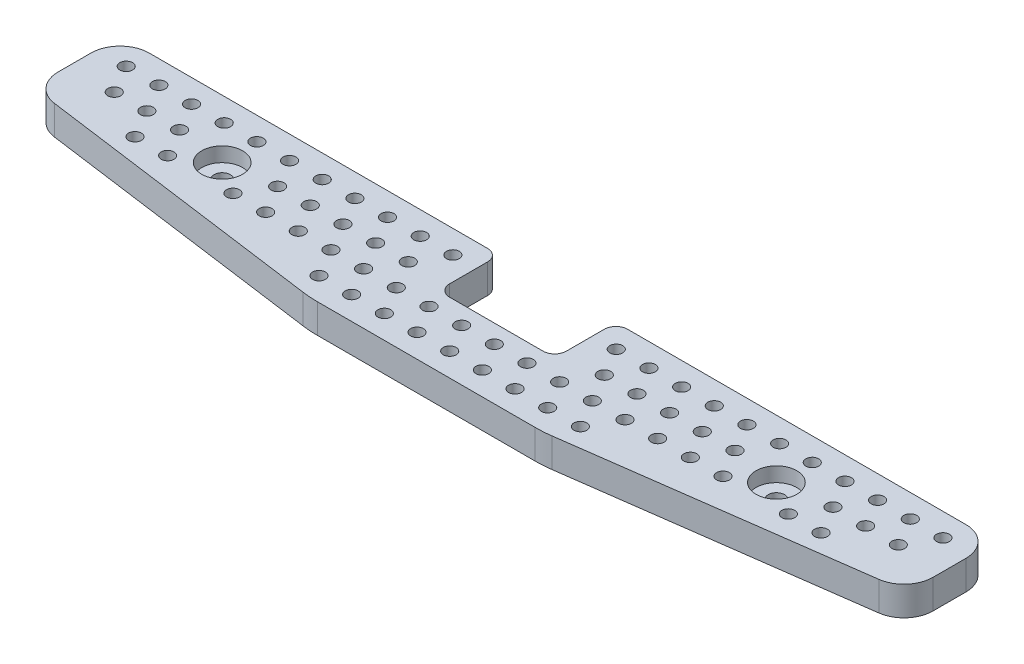
from build123d import *

# Parameters (mm, degrees)
SKETCH1_R               = 1.778
BOSS_EXTRUDE1_DEPTH     = 6.35
SKETCH2_R               = 1.397
CUT_EXTRUDE1_DEPTH      = 100.646453148
FILL_PATTERN1_OUTLINE_R = 1.397
FILL_PATTERN1_DEPTH     = 6.35
SKETCH3_R               = 4.445
CUT_EXTRUDE2_DEPTH      = 3.175


# Read off the part's stored shape, not the designer's step: Fill Pattern1
with BuildPart() as part:
    # Sketch1 → Boss-Extrude1 (new body)
    with BuildSketch(Plane(origin=(0, 0, 0), x_dir=(1, 0, 0), z_dir=(0, 1, 0))):
        with BuildLine():
            Line((23.676158632, 0), (-23.676158632, 0))
            ThreePointArc((-23.676158632, 0), (-25.396043626, 0.058295329), (-27.108034032, 0.232913732))
            Line((-27.108034032, 0.232913732), (-89.75796885, 8.776086661))
            ThreePointArc((-89.75796885, 8.776086661), (-93.68385839, 10.892071009), (-95.25, 15.067858228))
            Line((-95.25, 15.067858228), (-95.25, 22.225))
            ThreePointArc((-95.25, 22.225), (-93.390128061, 26.715128061), (-88.9, 28.575))
            Line((-88.9, 28.575), (-15.24, 28.575))
            ThreePointArc((-15.24, 28.575), (-13.443948776, 27.831051224), (-12.7, 26.035))
            Line((-12.7, 26.035), (-12.7, 17.78))
            ThreePointArc((-12.7, 17.78), (-11.956051224, 15.983948776), (-10.16, 15.24))
            Line((-10.16, 15.24), (10.16, 15.24))
            ThreePointArc((10.16, 15.24), (11.956051224, 15.983948776), (12.7, 17.78))
            Line((12.7, 17.78), (12.7, 26.035))
            ThreePointArc((12.7, 26.035), (13.443948776, 27.831051224), (15.24, 28.575))
            Line((15.24, 28.575), (88.9, 28.575))
            ThreePointArc((88.9, 28.575), (93.390128061, 26.715128061), (95.25, 22.225))
            Line((95.25, 22.225), (95.25, 15.067858228))
            ThreePointArc((95.25, 15.067858228), (93.68385839, 10.892071009), (89.75796885, 8.776086661))
            Line((89.75796885, 8.776086661), (27.108034032, 0.232913732))
            ThreePointArc((27.108034032, 0.232913732), (25.396043626, 0.058295329), (23.676158632, 0))
        make_face()
        with Locations(Location((-60.325, 15.875, 0), (0, 0, 270))):
            Circle(SKETCH1_R, mode=Mode.SUBTRACT)
        with Locations(Location((60.325, 15.875, 0), (0, 0, 90))):
            Circle(SKETCH1_R, mode=Mode.SUBTRACT)
    extrude(amount=BOSS_EXTRUDE1_DEPTH)

    # Sketch2 → Cut-Extrude1 (cut, through all)
    with BuildSketch(Plane(origin=(0, 0, 0), x_dir=(1, 0, 0), z_dir=(0, 1, 0))):
        with Locations(Location((0, 5.08, 0), (0, 0, 270))):
            Circle(SKETCH2_R)
    extrude(amount=CUT_EXTRUDE1_DEPTH, mode=Mode.SUBTRACT)

    # Fill Pattern1 outline → Fill Pattern1 (cut)
    with BuildSketch(Plane(origin=(0, 0, 0), x_dir=(1, 0, 0), z_dir=(0, 1, 0))):
        with Locations((-88.9, 23.557518015)):
            Circle(FILL_PATTERN1_OUTLINE_R)
        with Locations((-85.344, 17.398345343)):
            Circle(FILL_PATTERN1_OUTLINE_R)
        with Locations((-81.788, 23.557518015)):
            Circle(FILL_PATTERN1_OUTLINE_R)
        with Locations((-78.232, 17.398345343)):
            Circle(FILL_PATTERN1_OUTLINE_R)
        with Locations((-74.676, 23.557518015)):
            Circle(FILL_PATTERN1_OUTLINE_R)
        with Locations((-74.676, 11.239172672)):
            Circle(FILL_PATTERN1_OUTLINE_R)
        with Locations((-71.12, 17.398345343)):
            Circle(FILL_PATTERN1_OUTLINE_R)
        with Locations((-67.564, 23.557518015)):
            Circle(FILL_PATTERN1_OUTLINE_R)
        with Locations((-67.564, 11.239172672)):
            Circle(FILL_PATTERN1_OUTLINE_R)
        with Locations((-60.452, 23.557518015)):
            Circle(FILL_PATTERN1_OUTLINE_R)
        with Locations((-53.34, 23.557518015)):
            Circle(FILL_PATTERN1_OUTLINE_R)
        with Locations((-53.34, 11.239172672)):
            Circle(FILL_PATTERN1_OUTLINE_R)
        with Locations((-49.784, 17.398345343)):
            Circle(FILL_PATTERN1_OUTLINE_R)
        with Locations((-46.228, 23.557518015)):
            Circle(FILL_PATTERN1_OUTLINE_R)
        with Locations((-46.228, 11.239172672)):
            Circle(FILL_PATTERN1_OUTLINE_R)
        with Locations((-42.672, 17.398345343)):
            Circle(FILL_PATTERN1_OUTLINE_R)
        with Locations((-39.116, 23.557518015)):
            Circle(FILL_PATTERN1_OUTLINE_R)
        with Locations((-39.116, 11.239172672)):
            Circle(FILL_PATTERN1_OUTLINE_R)
        with Locations((-35.56, 17.398345343)):
            Circle(FILL_PATTERN1_OUTLINE_R)
        with Locations((-32.004, 23.557518015)):
            Circle(FILL_PATTERN1_OUTLINE_R)
        with Locations((-32.004, 11.239172672)):
            Circle(FILL_PATTERN1_OUTLINE_R)
        with Locations((-28.448, 17.398345343)):
            Circle(FILL_PATTERN1_OUTLINE_R)
        with Locations((-24.892, 23.557518015)):
            Circle(FILL_PATTERN1_OUTLINE_R)
        with Locations((-28.448, 5.08)):
            Circle(FILL_PATTERN1_OUTLINE_R)
        with Locations((-24.892, 11.239172672)):
            Circle(FILL_PATTERN1_OUTLINE_R)
        with Locations((-21.336, 17.398345343)):
            Circle(FILL_PATTERN1_OUTLINE_R)
        with Locations((-17.78, 23.557518015)):
            Circle(FILL_PATTERN1_OUTLINE_R)
        with Locations((-21.336, 5.08)):
            Circle(FILL_PATTERN1_OUTLINE_R)
        with Locations((-17.78, 11.239172672)):
            Circle(FILL_PATTERN1_OUTLINE_R)
        with Locations((-14.224, 5.08)):
            Circle(FILL_PATTERN1_OUTLINE_R)
        with Locations((-10.668, 11.239172672)):
            Circle(FILL_PATTERN1_OUTLINE_R)
        with Locations((-7.112, 5.08)):
            Circle(FILL_PATTERN1_OUTLINE_R)
        with Locations((-3.556, 11.239172672)):
            Circle(FILL_PATTERN1_OUTLINE_R)
        with Locations((3.556, 11.239172672)):
            Circle(FILL_PATTERN1_OUTLINE_R)
        with Locations((7.112, 5.08)):
            Circle(FILL_PATTERN1_OUTLINE_R)
        with Locations((10.668, 11.239172672)):
            Circle(FILL_PATTERN1_OUTLINE_R)
        with Locations((17.78, 23.557518015)):
            Circle(FILL_PATTERN1_OUTLINE_R)
        with Locations((14.224, 5.08)):
            Circle(FILL_PATTERN1_OUTLINE_R)
        with Locations((17.78, 11.239172672)):
            Circle(FILL_PATTERN1_OUTLINE_R)
        with Locations((21.336, 17.398345343)):
            Circle(FILL_PATTERN1_OUTLINE_R)
        with Locations((24.892, 23.557518015)):
            Circle(FILL_PATTERN1_OUTLINE_R)
        with Locations((21.336, 5.08)):
            Circle(FILL_PATTERN1_OUTLINE_R)
        with Locations((24.892, 11.239172672)):
            Circle(FILL_PATTERN1_OUTLINE_R)
        with Locations((28.448, 17.398345343)):
            Circle(FILL_PATTERN1_OUTLINE_R)
        with Locations((32.004, 23.557518015)):
            Circle(FILL_PATTERN1_OUTLINE_R)
        with Locations((28.448, 5.08)):
            Circle(FILL_PATTERN1_OUTLINE_R)
        with Locations((32.004, 11.239172672)):
            Circle(FILL_PATTERN1_OUTLINE_R)
        with Locations((35.56, 17.398345343)):
            Circle(FILL_PATTERN1_OUTLINE_R)
        with Locations((39.116, 23.557518015)):
            Circle(FILL_PATTERN1_OUTLINE_R)
        with Locations((39.116, 11.239172672)):
            Circle(FILL_PATTERN1_OUTLINE_R)
        with Locations((42.672, 17.398345343)):
            Circle(FILL_PATTERN1_OUTLINE_R)
        with Locations((46.228, 23.557518015)):
            Circle(FILL_PATTERN1_OUTLINE_R)
        with Locations((46.228, 11.239172672)):
            Circle(FILL_PATTERN1_OUTLINE_R)
        with Locations((49.784, 17.398345343)):
            Circle(FILL_PATTERN1_OUTLINE_R)
        with Locations((53.34, 23.557518015)):
            Circle(FILL_PATTERN1_OUTLINE_R)
        with Locations((53.34, 11.239172672)):
            Circle(FILL_PATTERN1_OUTLINE_R)
        with Locations((60.452, 23.557518015)):
            Circle(FILL_PATTERN1_OUTLINE_R)
        with Locations((67.564, 23.557518015)):
            Circle(FILL_PATTERN1_OUTLINE_R)
        with Locations((67.564, 11.239172672)):
            Circle(FILL_PATTERN1_OUTLINE_R)
        with Locations((71.12, 17.398345343)):
            Circle(FILL_PATTERN1_OUTLINE_R)
        with Locations((74.676, 23.557518015)):
            Circle(FILL_PATTERN1_OUTLINE_R)
        with Locations((74.676, 11.239172672)):
            Circle(FILL_PATTERN1_OUTLINE_R)
        with Locations((78.232, 17.398345343)):
            Circle(FILL_PATTERN1_OUTLINE_R)
        with Locations((81.788, 23.557518015)):
            Circle(FILL_PATTERN1_OUTLINE_R)
        with Locations((85.344, 17.398345343)):
            Circle(FILL_PATTERN1_OUTLINE_R)
        with Locations((88.9, 23.557518015)):
            Circle(FILL_PATTERN1_OUTLINE_R)
    extrude(amount=FILL_PATTERN1_DEPTH, mode=Mode.SUBTRACT)

    # Sketch3 → Cut-Extrude2 (cut)
    with BuildSketch(Plane(origin=(0, 6.35, 0), x_dir=(1, 0, 0), z_dir=(0, 1, 0))):
        with Locations(Location((-60.325, 15.875, 0), (0, 0, 270))):
            Circle(SKETCH3_R)
        with Locations(Location((60.325, 15.875, 0), (0, 0, 270))):
            Circle(SKETCH3_R)
    extrude(amount=-CUT_EXTRUDE2_DEPTH, mode=Mode.SUBTRACT)


solid = part.part
